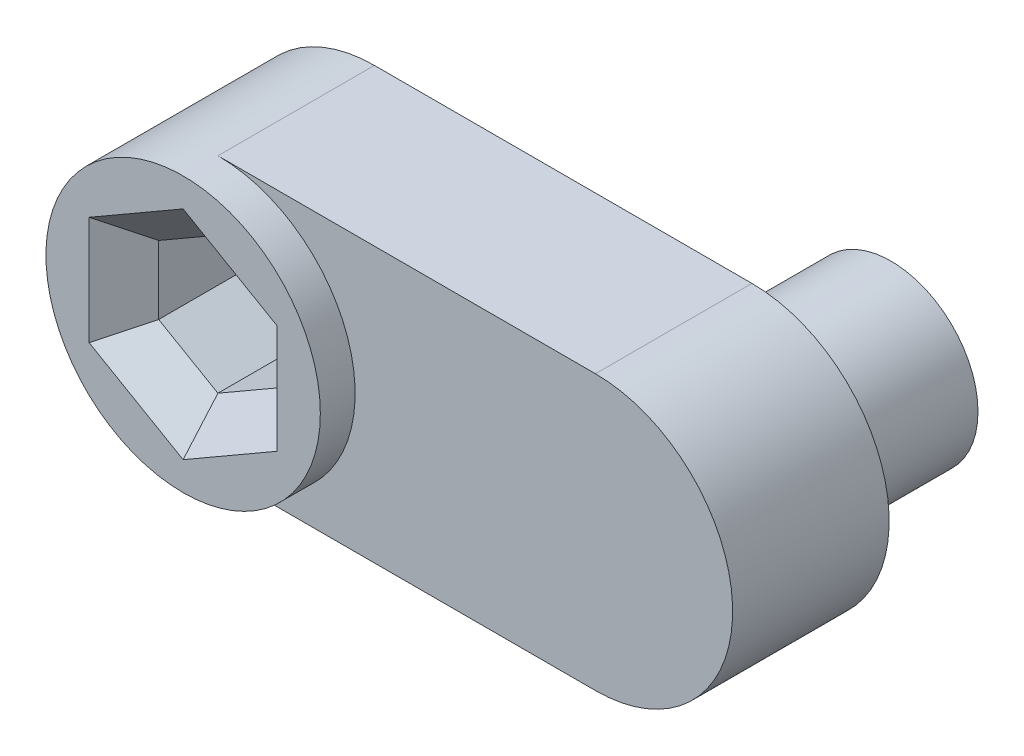
from build123d import *

# Parameters (mm, degrees)
BOSS_EXTRU_1_DEPTH      = 9
ESQUISSE3_R             = 5
BOSS_EXTRU_3_DEPTH      = 8
ENL_V_MAT_EXTRU_1_DEPTH = 27.507114611
ENL_V_MAT_EXTRU_2_DEPTH = 2
BOSS_EXTRU_4_DEPTH      = 2
CHANFREIN1_SIZE         = 2


with BuildPart() as part:
    # Esquisse1 → Boss.-Extru.1 (new body)
    with BuildSketch(Plane(origin=(0, 0, 0), x_dir=(0, 1, 0), z_dir=(0, 0, 1))):
        with BuildLine():
            Line((-7.89, -10.855), (-7.89, 10.855))
            ThreePointArc((-7.89, 10.855), (0, 18.745), (7.89, 10.855))
            Line((7.89, 10.855), (7.89, -10.855))
            ThreePointArc((7.89, -10.855), (0, -18.745), (-7.89, -10.855))
        make_face()
    extrude(amount=BOSS_EXTRU_1_DEPTH)

    # Esquisse3 → Boss.-Extru.3 (add)
    with BuildSketch(Plane(origin=(0, 0, 0), x_dir=(1, 0, 0), z_dir=(0, 0, -1))):
        with Locations((10.855, 0)):
            Circle(ESQUISSE3_R)
    extrude(amount=BOSS_EXTRU_3_DEPTH)

    # Esquisse2 → Enlèv. mat.-Extru.1 (cut, through all)
    with BuildSketch(Plane.XY.offset(9)):
        Polygon((-10.855, 3.935), (-14.262809964, 1.9675), (-14.262809964, -1.9675), (-10.855, -3.935), (-7.447190036, -1.9675), (-7.447190036, 1.9675), align=None)
    extrude(amount=-ENL_V_MAT_EXTRU_1_DEPTH, mode=Mode.SUBTRACT)

    # Esquisse4 → Enlèv. mat.-Extru.2 (cut)
    with BuildSketch(Plane(origin=(0, 0, 0), x_dir=(1, 0, 0), z_dir=(0, 0, -1))):
        Polygon((-5.447190036, -3.122200538), (-5.447190036, 3.122200538), (-10.855, 6.244401077), (-16.262809964, 3.122200538), (-16.262809964, -3.122200538), (-10.855, -6.244401077), align=None)
    extrude(amount=-ENL_V_MAT_EXTRU_2_DEPTH, mode=Mode.SUBTRACT)

    # Esquisse5 → Boss.-Extru.4 (add)
    with BuildSketch(Plane.XY.offset(9)):
        with BuildLine():
            ThreePointArc((-10.855, -7.89), (-5.275927496, -5.579072504), (-2.965, 0))
            ThreePointArc((-2.965, 0), (-5.275927496, 5.579072504), (-10.855, 7.89))
            ThreePointArc((-10.855, 7.89), (-18.745, 0), (-10.855, -7.89))
        make_face()
        Polygon((-10.855, 3.935), (-7.447190036, 1.9675), (-7.447190036, -1.9675), (-10.855, -3.935), (-14.262809964, -1.9675), (-14.262809964, 1.9675), align=None, mode=Mode.SUBTRACT)
    extrude(amount=BOSS_EXTRU_4_DEPTH)

    # Chanfrein1
    chanfrein1_edges = [part.edges().sort_by_distance(p)[0] for p in [
        (-9.151095018, 2.95125, 11),
        (-7.447190036, 0, 11),
        (-9.151095018, -2.95125, 11),
        (-12.558904982, -2.95125, 11),
        (-14.262809964, 0, 11),
        (-12.558904982, 2.95125, 11),
    ]]
    chamfer(chanfrein1_edges, length=CHANFREIN1_SIZE - 0.0001)  # a hair under: the kernel refuses the full size


solid = part.part
